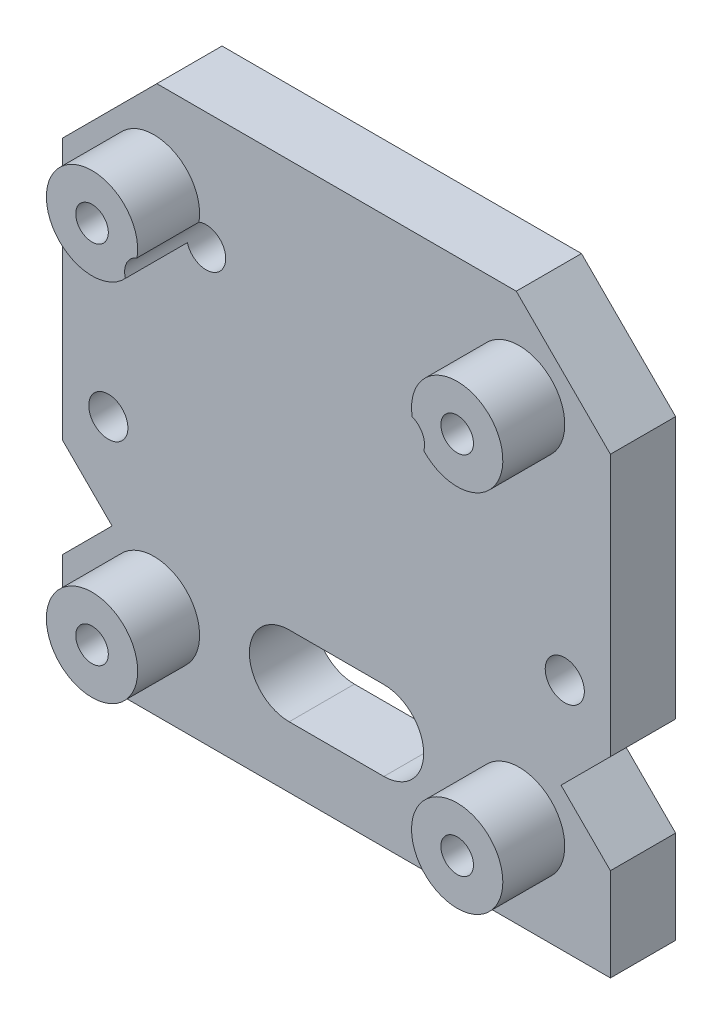
from build123d import *

# Parameters (mm, degrees)
SKETCH1_W           = 42
SKETCH1_H           = 42
SKETCH1_R           = 1.25
BOSS_EXTRUDE1_DEPTH = 5
CUT_EXTRUDE1_DEPTH  = 31.116440693
BOSS_EXTRUDE2_START = 4.75
SKETCH3_R           = 3.5
SKETCH3_R_2         = 1.25
BOSS_EXTRUDE2_DEPTH = 4.75
SKETCH4_R           = 1.5
CUT_EXTRUDE2_DEPTH  = 31.116440693


with BuildPart() as part:
    # Sketch1 → Boss-Extrude1 (new body)
    with BuildSketch(Plane.XY):
        Rectangle(SKETCH1_W, SKETCH1_H)
        with Locations((-14, 14)):
            Circle(SKETCH1_R, mode=Mode.SUBTRACT)
        with Locations((14, 14)):
            Circle(SKETCH1_R, mode=Mode.SUBTRACT)
        with Locations((14, -14)):
            Circle(SKETCH1_R, mode=Mode.SUBTRACT)
        with Locations((-14, -14)):
            Circle(SKETCH1_R, mode=Mode.SUBTRACT)
    extrude(amount=-BOSS_EXTRUDE1_DEPTH)

    # Sketch2 → Cut-Extrude1 (cut, through all)
    with BuildSketch(Plane.XY):
        with BuildLine():
            Line((-3.631627179, -10.198790609), (3.631230455, -10.198790609))
            ThreePointArc((3.631230455, -10.198790609), (6.681814195, -13.249374349), (3.631230455, -16.29995809))
            Line((3.631230455, -16.29995809), (-3.631627179, -16.29995809))
            ThreePointArc((-3.631627179, -16.29995809), (-6.68221092, -13.249374349), (-3.631627179, -10.198790609))
        make_face()
    extrude(amount=-CUT_EXTRUDE1_DEPTH, mode=Mode.SUBTRACT)

    # Sketch3 → Boss-Extrude2 (add)
    # profile 1 of 4: a face of its own
    with BuildSketch(Plane.XY.offset(BOSS_EXTRUDE2_START)):
        with Locations((-14, 14)):
            Circle(SKETCH3_R)
        with Locations((-14, 14)):
            Circle(SKETCH3_R_2, mode=Mode.SUBTRACT)
    # profile 2 of 4: a face of its own
    with BuildSketch(Plane.XY.offset(BOSS_EXTRUDE2_START)):
        with Locations((14, 14)):
            Circle(SKETCH3_R)
        with Locations((14, 14)):
            Circle(SKETCH3_R_2, mode=Mode.SUBTRACT)
    # profile 3 of 4: a face of its own
    with BuildSketch(Plane.XY.offset(BOSS_EXTRUDE2_START)):
        with Locations((-14, -14)):
            Circle(SKETCH3_R)
        with Locations((-14, -14)):
            Circle(SKETCH3_R_2, mode=Mode.SUBTRACT)
    # profile 4 of 4: a face of its own
    with BuildSketch(Plane.XY.offset(BOSS_EXTRUDE2_START)):
        with Locations((14, -14)):
            Circle(SKETCH3_R)
        with Locations((14, -14)):
            Circle(SKETCH3_R_2, mode=Mode.SUBTRACT)
    extrude(amount=-BOSS_EXTRUDE2_DEPTH)

    # Sketch4 → Cut-Extrude2 (cut, symmetric)
    with BuildSketch(Plane.XY):
        with Locations((-17.5, -2.974317447)):
            Circle(SKETCH4_R)
        with Locations((-10, 12.025682553)):
            Circle(SKETCH4_R)
        Polygon((-22.026703233, -5.276000217), (-17.213753003, -10.088950447), (-22.026703233, -14.901900677), align=None)
        Polygon((-21.705309187, 13.075826699), (-13.255294059, 21.525841828), (-21.705309187, 21.525841828), align=None)
    cut_extrude2 = extrude(amount=CUT_EXTRUDE2_DEPTH, both=True, mode=Mode.SUBTRACT)

    # Mirror1: Cut-Extrude2 across plane
    add(cut_extrude2.mirror(Plane(origin=(0, 0, 0), x_dir=(0, 0, 1), z_dir=(1, 0, 0))), mode=Mode.SUBTRACT)


solid = part.part
